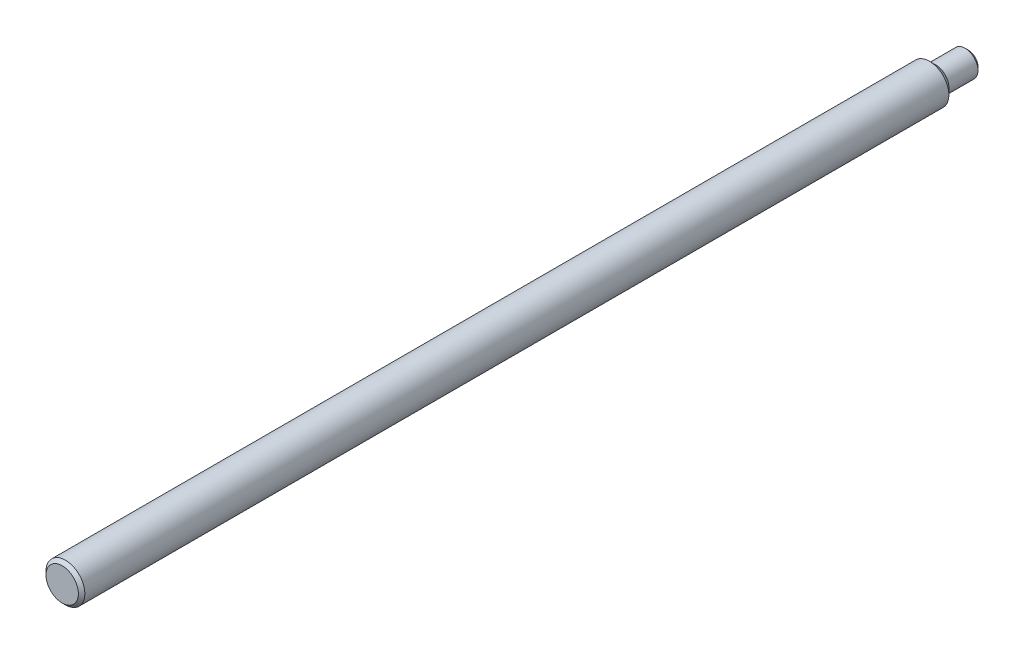
from build123d import *

# Parameters (mm, degrees)
SCHIZZO1_R                   = 6
ESTRUSIONE_ESTRUSIONE1_DEPTH = 280
SMUSSO1_SIZE                 = 1


with BuildPart() as part:
    # Schizzo1 → Estrusione-Estrusione1 (new body)
    with BuildSketch(Plane.XY):
        Circle(SCHIZZO1_R)
    extrude(amount=ESTRUSIONE_ESTRUSIONE1_DEPTH)

    # Schizzo2 → Taglia-Rivoluzione1 (revolve, cut)
    with BuildSketch(Plane(origin=(0, 0, 0), x_dir=(1, 0, 0), z_dir=(0, 1, 0))):
        Polygon((-4, -10), (-6, -12), (-6, 0), (-4, 0), align=None)
    revolve(axis=Axis((0, 0, -1.898721367), (0, 0, 1)), mode=Mode.SUBTRACT)

    # Smusso1
    smusso1_edges = [part.edges().sort_by_distance(p)[0] for p in [
        (4, 0, 0),
        (-6, 0, 280),
    ]]
    chamfer(smusso1_edges, length=SMUSSO1_SIZE)


solid = part.part
